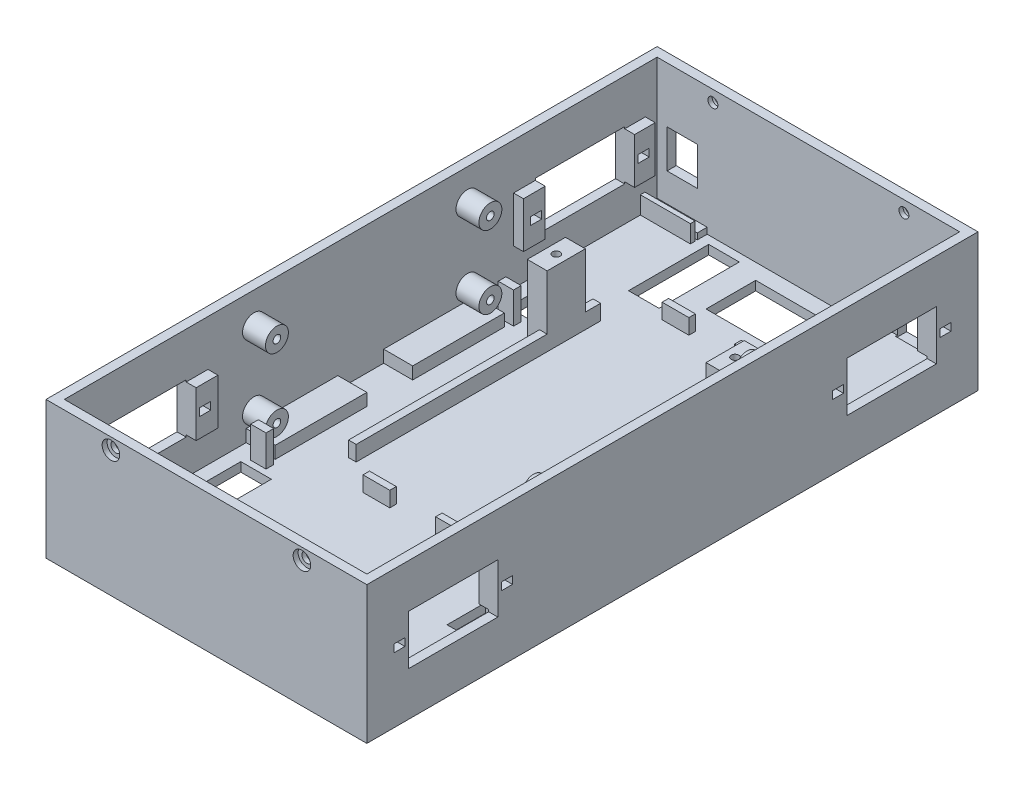
from build123d import *

# Parameters (mm, degrees)
BOSS_EXTRUDE1_START  = -80
SKETCH1_W            = 84
SKETCH1_H            = 36
BOSS_EXTRUDE1_DEPTH  = 160
BOSS_EXTRUDE2_START  = -77.6
SKETCH2_W            = 79.2
SKETCH2_H            = 38.6
BOSS_EXTRUDE2_DEPTH  = 155.2
BOSS_EXTRUDE3_START  = -74.5
SKETCH3_W            = 2.6
SKETCH3_H            = 12
BOSS_EXTRUDE3_DEPTH  = 34.5
BOSS_EXTRUDE4_START  = -69.1
SKETCH4_W            = 7.8
SKETCH4_H            = 13
BOSS_EXTRUDE4_DEPTH  = 23.4
BOSS_EXTRUDE5_START  = -72.925
SKETCH5_W            = 7.8
SKETCH5_H            = 2
BOSS_EXTRUDE5_DEPTH  = 2.9
BOSS_EXTRUDE6_START  = -44.775
SKETCH6_W            = 7.8
SKETCH6_H            = 2
BOSS_EXTRUDE6_DEPTH  = 2.9
BOSS_EXTRUDE7_START  = -45
SKETCH7_W            = 8
SKETCH7_H            = 4.4
BOSS_EXTRUDE7_DEPTH  = 10
BOSS_EXTRUDE8_START  = 40
SKETCH8_W            = 2.6
SKETCH8_H            = 12
BOSS_EXTRUDE8_DEPTH  = 34.5
BOSS_EXTRUDE9_START  = 45.7
SKETCH9_W            = 7.8
SKETCH9_H            = 13
BOSS_EXTRUDE9_DEPTH  = 23.4
BOSS_EXTRUDE10_START = 41.875
SKETCH10_W           = 7.8
SKETCH10_H           = 2
BOSS_EXTRUDE10_DEPTH = 2.9
BOSS_EXTRUDE11_START = 70.025
SKETCH11_W           = 7.8
SKETCH11_H           = 2
BOSS_EXTRUDE11_DEPTH = 2.9
BOSS_EXTRUDE12_START = 35
SKETCH12_W           = 8
SKETCH12_H           = 4.4
BOSS_EXTRUDE12_DEPTH = 10
BOSS_EXTRUDE13_START = -39.6
SKETCH13_R           = 3
BOSS_EXTRUDE13_DEPTH = 6
BOSS_EXTRUDE14_START = -40.4
SKETCH14_R           = 1
BOSS_EXTRUDE14_DEPTH = 7.4
BOSS_EXTRUDE15_START = -39.6
SKETCH15_R           = 3
BOSS_EXTRUDE15_DEPTH = 6
BOSS_EXTRUDE16_START = -40.4
SKETCH16_R           = 1
BOSS_EXTRUDE16_DEPTH = 7.4
BOSS_EXTRUDE17_START = -39.6
SKETCH17_R           = 3
BOSS_EXTRUDE17_DEPTH = 6
BOSS_EXTRUDE18_START = -40.4
SKETCH18_R           = 1
BOSS_EXTRUDE18_DEPTH = 7.4
BOSS_EXTRUDE19_START = -39.6
SKETCH19_R           = 3
BOSS_EXTRUDE19_DEPTH = 6
BOSS_EXTRUDE20_START = -40.4
SKETCH20_R           = 1
BOSS_EXTRUDE20_DEPTH = 7.4
BOSS_EXTRUDE21_START = -30
SKETCH21_W           = 7.6
SKETCH21_H           = 3.2
BOSS_EXTRUDE21_DEPTH = 24
BOSS_EXTRUDE22_START = 6
SKETCH22_W           = 7.6
SKETCH22_H           = 3.2
BOSS_EXTRUDE22_DEPTH = 24
BOSS_EXTRUDE23_START = 31.4
SKETCH23_W           = 4
SKETCH23_H           = 8.2
BOSS_EXTRUDE23_DEPTH = 2
BOSS_EXTRUDE24_START = -33.4
SKETCH24_W           = 4
SKETCH24_H           = 8.2
BOSS_EXTRUDE24_DEPTH = 2
BOSS_EXTRUDE25_START = -44
SKETCH25_W           = 2
SKETCH25_H           = 4
BOSS_EXTRUDE25_DEPTH = 64
BOSS_EXTRUDE26_START = -40
SKETCH26_W           = 5.2
SKETCH26_H           = 18.35
BOSS_EXTRUDE26_DEPTH = 10
BOSS_EXTRUDE27_START = 8
SKETCH27_R           = 1
BOSS_EXTRUDE27_DEPTH = 13.75
BOSS_EXTRUDE28_START = 54.5
SKETCH28_W           = 8
SKETCH28_H           = 4.4
BOSS_EXTRUDE28_DEPTH = 21
BOSS_EXTRUDE29_START = -74.5
SKETCH29_W           = 2.6
SKETCH29_H           = 12
BOSS_EXTRUDE29_DEPTH = 34.5
BOSS_EXTRUDE30_START = -69.1
SKETCH30_W           = 7.8
SKETCH30_H           = 13
BOSS_EXTRUDE30_DEPTH = 23.4
BOSS_EXTRUDE31_START = -72.925
SKETCH31_W           = 7.8
SKETCH31_H           = 2
BOSS_EXTRUDE31_DEPTH = 2.9
BOSS_EXTRUDE32_START = -44.775
SKETCH32_W           = 7.8
SKETCH32_H           = 2
BOSS_EXTRUDE32_DEPTH = 2.9
BOSS_EXTRUDE33_START = -45
SKETCH33_W           = 8
SKETCH33_H           = 4.4
BOSS_EXTRUDE33_DEPTH = 10
BOSS_EXTRUDE34_START = 40
SKETCH34_W           = 2.6
SKETCH34_H           = 12
BOSS_EXTRUDE34_DEPTH = 34.5
BOSS_EXTRUDE35_START = 45.7
SKETCH35_W           = 7.8
SKETCH35_H           = 13
BOSS_EXTRUDE35_DEPTH = 23.4
BOSS_EXTRUDE36_START = 41.875
SKETCH36_W           = 7.8
SKETCH36_H           = 2
BOSS_EXTRUDE36_DEPTH = 2.9
BOSS_EXTRUDE37_START = 70.025
SKETCH37_W           = 7.8
SKETCH37_H           = 2
BOSS_EXTRUDE37_DEPTH = 2.9
BOSS_EXTRUDE38_START = 35
SKETCH38_W           = 8
SKETCH38_H           = 4.4
BOSS_EXTRUDE38_DEPTH = 10
BOSS_EXTRUDE39_START = 33.6
SKETCH39_R           = 3
BOSS_EXTRUDE39_DEPTH = 6
BOSS_EXTRUDE40_START = 33
SKETCH40_R           = 1
BOSS_EXTRUDE40_DEPTH = 7.4
BOSS_EXTRUDE41_START = 33.6
SKETCH41_R           = 3
BOSS_EXTRUDE41_DEPTH = 6
BOSS_EXTRUDE42_START = 33
SKETCH42_R           = 1
BOSS_EXTRUDE42_DEPTH = 7.4
BOSS_EXTRUDE43_START = 33.6
SKETCH43_R           = 3
BOSS_EXTRUDE43_DEPTH = 6
BOSS_EXTRUDE44_START = 33
SKETCH44_R           = 1
BOSS_EXTRUDE44_DEPTH = 7.4
BOSS_EXTRUDE45_START = 33.6
SKETCH45_R           = 3
BOSS_EXTRUDE45_DEPTH = 6
BOSS_EXTRUDE46_START = 33
SKETCH46_R           = 1
BOSS_EXTRUDE46_DEPTH = 7.4
BOSS_EXTRUDE47_START = -30
SKETCH47_W           = 7.6
SKETCH47_H           = 3.2
BOSS_EXTRUDE47_DEPTH = 24
BOSS_EXTRUDE48_START = 6
SKETCH48_W           = 7.6
SKETCH48_H           = 3.2
BOSS_EXTRUDE48_DEPTH = 24
BOSS_EXTRUDE49_START = 31.4
SKETCH49_W           = 4
SKETCH49_H           = 8.2
BOSS_EXTRUDE49_DEPTH = 2
BOSS_EXTRUDE50_START = -33.4
SKETCH50_W           = 4
SKETCH50_H           = 8.2
BOSS_EXTRUDE50_DEPTH = 2
BOSS_EXTRUDE51_START = -44
SKETCH51_W           = 2
SKETCH51_H           = 4
BOSS_EXTRUDE51_DEPTH = 64
BOSS_EXTRUDE52_START = -40
SKETCH52_W           = 5.2
SKETCH52_H           = 18.35
BOSS_EXTRUDE52_DEPTH = 10
BOSS_EXTRUDE53_START = 8
SKETCH53_R           = 1
BOSS_EXTRUDE53_DEPTH = 13.75
BOSS_EXTRUDE54_START = 54.5
SKETCH54_W           = 8
SKETCH54_H           = 4.4
BOSS_EXTRUDE54_DEPTH = 21
BOSS_EXTRUDE55_START = -54
SKETCH55_W           = 7
SKETCH55_H           = 4
BOSS_EXTRUDE55_DEPTH = 1.7
BOSS_EXTRUDE56_START = -54
SKETCH56_W           = 7
SKETCH56_H           = 4
BOSS_EXTRUDE56_DEPTH = 1.7
BOSS_EXTRUDE57_START = 24.3
SKETCH57_W           = 7
SKETCH57_H           = 4
BOSS_EXTRUDE57_DEPTH = 1.7
BOSS_EXTRUDE58_START = 24.3
SKETCH58_W           = 7
SKETCH58_H           = 4
BOSS_EXTRUDE58_DEPTH = 1.7
BOSS_EXTRUDE59_START = -75.5
SKETCH59_W           = 8
SKETCH59_H           = 4.4
BOSS_EXTRUDE59_DEPTH = 21
BOSS_EXTRUDE60_START = -73.5
SKETCH60_W           = 19.4
SKETCH60_H           = 4.4
BOSS_EXTRUDE60_DEPTH = 13
BOSS_EXTRUDE61_START = -77.6
SKETCH61_W           = 18
SKETCH61_H           = 2
BOSS_EXTRUDE61_DEPTH = 31
BOSS_EXTRUDE62_START = -75
SKETCH62_W           = 1.8
SKETCH62_H           = 5
BOSS_EXTRUDE62_DEPTH = 22
BOSS_EXTRUDE63_START = -46.4
SKETCH63_W           = 18.3
SKETCH63_H           = 5
BOSS_EXTRUDE63_DEPTH = 1.2
BOSS_EXTRUDE64_START = -81
SKETCH64_W           = 14
SKETCH64_H           = 7.5
BOSS_EXTRUDE64_DEPTH = 3.9
BOSS_EXTRUDE65_START = -77.6
SKETCH65_W           = 13.1
SKETCH65_H           = 1.6
BOSS_EXTRUDE65_DEPTH = 2.6
BOSS_EXTRUDE66_START = -74.4
SKETCH66_W           = 13.1
SKETCH66_H           = 4.6
BOSS_EXTRUDE66_DEPTH = 1.2
BOSS_EXTRUDE67_START = -81
SKETCH67_W           = 8
SKETCH67_H           = 10
BOSS_EXTRUDE67_DEPTH = 3.9
BOSS_EXTRUDE68_START = -81
SKETCH68_R           = 1.3
BOSS_EXTRUDE68_DEPTH = 4.4
BOSS_EXTRUDE69_START = -81
SKETCH69_R           = 2.3
BOSS_EXTRUDE69_DEPTH = 2.3
BOSS_EXTRUDE70_START = -81
SKETCH70_R           = 1.3
BOSS_EXTRUDE70_DEPTH = 4.4
BOSS_EXTRUDE71_START = -81
SKETCH71_R           = 2.3
BOSS_EXTRUDE71_DEPTH = 2.3
BOSS_EXTRUDE72_START = 76.6
SKETCH72_R           = 1.3
BOSS_EXTRUDE72_DEPTH = 4.4
BOSS_EXTRUDE73_START = 78.7
SKETCH73_R           = 2.3
BOSS_EXTRUDE73_DEPTH = 2.3
BOSS_EXTRUDE74_START = 76.6
SKETCH74_R           = 1.3
BOSS_EXTRUDE74_DEPTH = 4.4
BOSS_EXTRUDE75_START = 78.7
SKETCH75_R           = 2.3
BOSS_EXTRUDE75_DEPTH = 2.3


with BuildPart() as part:
    # Sketch1 → Boss-Extrude1 (new body)
    with BuildSketch(Plane.XY.offset(BOSS_EXTRUDE1_START)):
        with Locations((0, 18)):
            Rectangle(SKETCH1_W, SKETCH1_H)
    extrude(amount=BOSS_EXTRUDE1_DEPTH)


with BuildPart() as body_2:
    # Sketch2 → Boss-Extrude2 (new body)
    with BuildSketch(Plane.XY.offset(BOSS_EXTRUDE2_START)):
        with Locations((0, 21.7)):
            Rectangle(SKETCH2_W, SKETCH2_H)
    extrude(amount=BOSS_EXTRUDE2_DEPTH)


with BuildPart() as part_1:
    add(part.part)

    # Combine1: cut body 2
    add(body_2.part, mode=Mode.SUBTRACT)

    # Sketch3 → Boss-Extrude3 (add)
    with BuildSketch(Plane.XY.offset(BOSS_EXTRUDE3_START)):
        with Locations((-38.3, 18)):
            Rectangle(SKETCH3_W, SKETCH3_H)
    extrude(amount=BOSS_EXTRUDE3_DEPTH)


with BuildPart() as body_2_2:
    # Sketch4 → Boss-Extrude4 (new body)
    with BuildSketch(Plane.XY.offset(BOSS_EXTRUDE4_START)):
        with Locations((-39.1, 18)):
            Rectangle(SKETCH4_W, SKETCH4_H)
    extrude(amount=BOSS_EXTRUDE4_DEPTH)


with BuildPart() as part_2:
    add(part_1.part)

    # Combine2: cut body 2 2
    add(body_2_2.part, mode=Mode.SUBTRACT)


with BuildPart() as body_2_3:
    # Sketch5 → Boss-Extrude5 (new body)
    with BuildSketch(Plane.XY.offset(BOSS_EXTRUDE5_START)):
        with Locations((-39.1, 18)):
            Rectangle(SKETCH5_W, SKETCH5_H)
    extrude(amount=BOSS_EXTRUDE5_DEPTH)


with BuildPart() as part_3:
    add(part_2.part)

    # Combine3: cut body 2 3
    add(body_2_3.part, mode=Mode.SUBTRACT)


with BuildPart() as body_2_4:
    # Sketch6 → Boss-Extrude6 (new body)
    with BuildSketch(Plane.XY.offset(BOSS_EXTRUDE6_START)):
        with Locations((-39.1, 18)):
            Rectangle(SKETCH6_W, SKETCH6_H)
    extrude(amount=BOSS_EXTRUDE6_DEPTH)


with BuildPart() as part_4:
    add(part_3.part)

    # Combine4: cut body 2 4
    add(body_2_4.part, mode=Mode.SUBTRACT)


with BuildPart() as body_2_5:
    # Sketch7 → Boss-Extrude7 (new body)
    with BuildSketch(Plane.XY.offset(BOSS_EXTRUDE7_START)):
        with Locations((-32, 1.2)):
            Rectangle(SKETCH7_W, SKETCH7_H)
    extrude(amount=BOSS_EXTRUDE7_DEPTH)


with BuildPart() as part_5:
    add(part_4.part)

    # Combine5: cut body 2 5
    add(body_2_5.part, mode=Mode.SUBTRACT)

    # Sketch8 → Boss-Extrude8 (add)
    with BuildSketch(Plane.XY.offset(BOSS_EXTRUDE8_START)):
        with Locations((-38.3, 18)):
            Rectangle(SKETCH8_W, SKETCH8_H)
    extrude(amount=BOSS_EXTRUDE8_DEPTH)


with BuildPart() as body_2_6:
    # Sketch9 → Boss-Extrude9 (new body)
    with BuildSketch(Plane.XY.offset(BOSS_EXTRUDE9_START)):
        with Locations((-39.1, 18)):
            Rectangle(SKETCH9_W, SKETCH9_H)
    extrude(amount=BOSS_EXTRUDE9_DEPTH)


with BuildPart() as part_6:
    add(part_5.part)

    # Combine6: cut body 2 6
    add(body_2_6.part, mode=Mode.SUBTRACT)


with BuildPart() as body_2_7:
    # Sketch10 → Boss-Extrude10 (new body)
    with BuildSketch(Plane.XY.offset(BOSS_EXTRUDE10_START)):
        with Locations((-39.1, 18)):
            Rectangle(SKETCH10_W, SKETCH10_H)
    extrude(amount=BOSS_EXTRUDE10_DEPTH)


with BuildPart() as part_7:
    add(part_6.part)

    # Combine7: cut body 2 7
    add(body_2_7.part, mode=Mode.SUBTRACT)


with BuildPart() as body_2_8:
    # Sketch11 → Boss-Extrude11 (new body)
    with BuildSketch(Plane.XY.offset(BOSS_EXTRUDE11_START)):
        with Locations((-39.1, 18)):
            Rectangle(SKETCH11_W, SKETCH11_H)
    extrude(amount=BOSS_EXTRUDE11_DEPTH)


with BuildPart() as part_8:
    add(part_7.part)

    # Combine8: cut body 2 8
    add(body_2_8.part, mode=Mode.SUBTRACT)


with BuildPart() as body_2_9:
    # Sketch12 → Boss-Extrude12 (new body)
    with BuildSketch(Plane.XY.offset(BOSS_EXTRUDE12_START)):
        with Locations((-32, 1.2)):
            Rectangle(SKETCH12_W, SKETCH12_H)
    extrude(amount=BOSS_EXTRUDE12_DEPTH)


with BuildPart() as part_9:
    add(part_8.part)

    # Combine9: cut body 2 9
    add(body_2_9.part, mode=Mode.SUBTRACT)

    # Sketch13 → Boss-Extrude13 (add)
    with BuildSketch(Plane(origin=(0, 0, 0), x_dir=(0, 0, -1), z_dir=(1, 0, 0)).offset(BOSS_EXTRUDE13_START)):
        with Locations((27.94, 8.775)):
            Circle(SKETCH13_R)
    extrude(amount=BOSS_EXTRUDE13_DEPTH)


with BuildPart() as body_2_10:
    # Sketch14 → Boss-Extrude14 (new body)
    with BuildSketch(Plane(origin=(0, 0, 0), x_dir=(0, 0, -1), z_dir=(1, 0, 0)).offset(BOSS_EXTRUDE14_START)):
        with Locations((27.94, 8.775)):
            Circle(SKETCH14_R)
    extrude(amount=BOSS_EXTRUDE14_DEPTH)


with BuildPart() as part_10:
    add(part_9.part)

    # Combine10: cut body 2 10
    add(body_2_10.part, mode=Mode.SUBTRACT)

    # Sketch15 → Boss-Extrude15 (add)
    with BuildSketch(Plane(origin=(0, 0, 0), x_dir=(0, 0, -1), z_dir=(1, 0, 0)).offset(BOSS_EXTRUDE15_START)):
        with Locations((27.94, 27.825)):
            Circle(SKETCH15_R)
    extrude(amount=BOSS_EXTRUDE15_DEPTH)


with BuildPart() as body_2_11:
    # Sketch16 → Boss-Extrude16 (new body)
    with BuildSketch(Plane(origin=(0, 0, 0), x_dir=(0, 0, -1), z_dir=(1, 0, 0)).offset(BOSS_EXTRUDE16_START)):
        with Locations((27.94, 27.825)):
            Circle(SKETCH16_R)
    extrude(amount=BOSS_EXTRUDE16_DEPTH)


with BuildPart() as part_11:
    add(part_10.part)

    # Combine11: cut body 2 11
    add(body_2_11.part, mode=Mode.SUBTRACT)

    # Sketch17 → Boss-Extrude17 (add)
    with BuildSketch(Plane(origin=(0, 0, 0), x_dir=(0, 0, -1), z_dir=(1, 0, 0)).offset(BOSS_EXTRUDE17_START)):
        with Locations((-27.94, 8.775)):
            Circle(SKETCH17_R)
    extrude(amount=BOSS_EXTRUDE17_DEPTH)


with BuildPart() as body_2_12:
    # Sketch18 → Boss-Extrude18 (new body)
    with BuildSketch(Plane(origin=(0, 0, 0), x_dir=(0, 0, -1), z_dir=(1, 0, 0)).offset(BOSS_EXTRUDE18_START)):
        with Locations((-27.94, 8.775)):
            Circle(SKETCH18_R)
    extrude(amount=BOSS_EXTRUDE18_DEPTH)


with BuildPart() as part_12:
    add(part_11.part)

    # Combine12: cut body 2 12
    add(body_2_12.part, mode=Mode.SUBTRACT)

    # Sketch19 → Boss-Extrude19 (add)
    with BuildSketch(Plane(origin=(0, 0, 0), x_dir=(0, 0, -1), z_dir=(1, 0, 0)).offset(BOSS_EXTRUDE19_START)):
        with Locations((-27.94, 27.825)):
            Circle(SKETCH19_R)
    extrude(amount=BOSS_EXTRUDE19_DEPTH)


with BuildPart() as body_2_13:
    # Sketch20 → Boss-Extrude20 (new body)
    with BuildSketch(Plane(origin=(0, 0, 0), x_dir=(0, 0, -1), z_dir=(1, 0, 0)).offset(BOSS_EXTRUDE20_START)):
        with Locations((-27.94, 27.825)):
            Circle(SKETCH20_R)
    extrude(amount=BOSS_EXTRUDE20_DEPTH)


with BuildPart() as part_13:
    add(part_12.part)

    # Combine13: cut body 2 13
    add(body_2_13.part, mode=Mode.SUBTRACT)

    # Sketch21 → Boss-Extrude21 (add)
    with BuildSketch(Plane.XY.offset(BOSS_EXTRUDE21_START)):
        with Locations((-35.8, 4)):
            Rectangle(SKETCH21_W, SKETCH21_H)
    extrude(amount=BOSS_EXTRUDE21_DEPTH)

    # Sketch22 → Boss-Extrude22 (add)
    with BuildSketch(Plane.XY.offset(BOSS_EXTRUDE22_START)):
        with Locations((-35.8, 4)):
            Rectangle(SKETCH22_W, SKETCH22_H)
    extrude(amount=BOSS_EXTRUDE22_DEPTH)

    # Sketch23 → Boss-Extrude23 (add)
    with BuildSketch(Plane.XY.offset(BOSS_EXTRUDE23_START)):
        with Locations((-33, 6.5)):
            Rectangle(SKETCH23_W, SKETCH23_H)
    extrude(amount=BOSS_EXTRUDE23_DEPTH)

    # Sketch24 → Boss-Extrude24 (add)
    with BuildSketch(Plane.XY.offset(BOSS_EXTRUDE24_START)):
        with Locations((-33, 6.5)):
            Rectangle(SKETCH24_W, SKETCH24_H)
    extrude(amount=BOSS_EXTRUDE24_DEPTH)

    # Sketch25 → Boss-Extrude25 (add)
    with BuildSketch(Plane.XY.offset(BOSS_EXTRUDE25_START)):
        with Locations((-21.8, 4.4)):
            Rectangle(SKETCH25_W, SKETCH25_H)
    extrude(amount=BOSS_EXTRUDE25_DEPTH)

    # Sketch26 → Boss-Extrude26 (add)
    with BuildSketch(Plane.XY.offset(BOSS_EXTRUDE26_START)):
        with Locations((-23.4, 11.575)):
            Rectangle(SKETCH26_W, SKETCH26_H)
    extrude(amount=BOSS_EXTRUDE26_DEPTH)


with BuildPart() as body_2_14:
    # Sketch27 → Boss-Extrude27 (new body)
    with BuildSketch(Plane(origin=(0, 0, 0), x_dir=(1, 0, 0), z_dir=(0, 1, 0)).offset(BOSS_EXTRUDE27_START)):
        with Locations((-23.4, 35)):
            Circle(SKETCH27_R)
    extrude(amount=BOSS_EXTRUDE27_DEPTH)


with BuildPart() as part_14:
    add(part_13.part)

    # Combine14: cut body 2 14
    add(body_2_14.part, mode=Mode.SUBTRACT)


with BuildPart() as body_2_15:
    # Sketch28 → Boss-Extrude28 (new body)
    with BuildSketch(Plane.XY.offset(BOSS_EXTRUDE28_START)):
        with Locations((-20, 1.2)):
            Rectangle(SKETCH28_W, SKETCH28_H)
    extrude(amount=BOSS_EXTRUDE28_DEPTH)


with BuildPart() as part_15:
    add(part_14.part)

    # Combine15: cut body 2 15
    add(body_2_15.part, mode=Mode.SUBTRACT)

    # Sketch29 → Boss-Extrude29 (add)
    with BuildSketch(Plane.XY.offset(BOSS_EXTRUDE29_START)):
        with Locations((38.3, 18)):
            Rectangle(SKETCH29_W, SKETCH29_H)
    extrude(amount=BOSS_EXTRUDE29_DEPTH)


with BuildPart() as body_2_16:
    # Sketch30 → Boss-Extrude30 (new body)
    with BuildSketch(Plane.XY.offset(BOSS_EXTRUDE30_START)):
        with Locations((39.1, 18)):
            Rectangle(SKETCH30_W, SKETCH30_H)
    extrude(amount=BOSS_EXTRUDE30_DEPTH)


with BuildPart() as part_16:
    add(part_15.part)

    # Combine16: cut body 2 16
    add(body_2_16.part, mode=Mode.SUBTRACT)


with BuildPart() as body_2_17:
    # Sketch31 → Boss-Extrude31 (new body)
    with BuildSketch(Plane.XY.offset(BOSS_EXTRUDE31_START)):
        with Locations((39.1, 18)):
            Rectangle(SKETCH31_W, SKETCH31_H)
    extrude(amount=BOSS_EXTRUDE31_DEPTH)


with BuildPart() as part_17:
    add(part_16.part)

    # Combine17: cut body 2 17
    add(body_2_17.part, mode=Mode.SUBTRACT)


with BuildPart() as body_2_18:
    # Sketch32 → Boss-Extrude32 (new body)
    with BuildSketch(Plane.XY.offset(BOSS_EXTRUDE32_START)):
        with Locations((39.1, 18)):
            Rectangle(SKETCH32_W, SKETCH32_H)
    extrude(amount=BOSS_EXTRUDE32_DEPTH)


with BuildPart() as part_18:
    add(part_17.part)

    # Combine18: cut body 2 18
    add(body_2_18.part, mode=Mode.SUBTRACT)


with BuildPart() as body_2_19:
    # Sketch33 → Boss-Extrude33 (new body)
    with BuildSketch(Plane.XY.offset(BOSS_EXTRUDE33_START)):
        with Locations((32, 1.2)):
            Rectangle(SKETCH33_W, SKETCH33_H)
    extrude(amount=BOSS_EXTRUDE33_DEPTH)


with BuildPart() as part_19:
    add(part_18.part)

    # Combine19: cut body 2 19
    add(body_2_19.part, mode=Mode.SUBTRACT)

    # Sketch34 → Boss-Extrude34 (add)
    with BuildSketch(Plane.XY.offset(BOSS_EXTRUDE34_START)):
        with Locations((38.3, 18)):
            Rectangle(SKETCH34_W, SKETCH34_H)
    extrude(amount=BOSS_EXTRUDE34_DEPTH)


with BuildPart() as body_2_20:
    # Sketch35 → Boss-Extrude35 (new body)
    with BuildSketch(Plane.XY.offset(BOSS_EXTRUDE35_START)):
        with Locations((39.1, 18)):
            Rectangle(SKETCH35_W, SKETCH35_H)
    extrude(amount=BOSS_EXTRUDE35_DEPTH)


with BuildPart() as part_20:
    add(part_19.part)

    # Combine20: cut body 2 20
    add(body_2_20.part, mode=Mode.SUBTRACT)


with BuildPart() as body_2_21:
    # Sketch36 → Boss-Extrude36 (new body)
    with BuildSketch(Plane.XY.offset(BOSS_EXTRUDE36_START)):
        with Locations((39.1, 18)):
            Rectangle(SKETCH36_W, SKETCH36_H)
    extrude(amount=BOSS_EXTRUDE36_DEPTH)


with BuildPart() as part_21:
    add(part_20.part)

    # Combine21: cut body 2 21
    add(body_2_21.part, mode=Mode.SUBTRACT)


with BuildPart() as body_2_22:
    # Sketch37 → Boss-Extrude37 (new body)
    with BuildSketch(Plane.XY.offset(BOSS_EXTRUDE37_START)):
        with Locations((39.1, 18)):
            Rectangle(SKETCH37_W, SKETCH37_H)
    extrude(amount=BOSS_EXTRUDE37_DEPTH)


with BuildPart() as part_22:
    add(part_21.part)

    # Combine22: cut body 2 22
    add(body_2_22.part, mode=Mode.SUBTRACT)


with BuildPart() as body_2_23:
    # Sketch38 → Boss-Extrude38 (new body)
    with BuildSketch(Plane.XY.offset(BOSS_EXTRUDE38_START)):
        with Locations((32, 1.2)):
            Rectangle(SKETCH38_W, SKETCH38_H)
    extrude(amount=BOSS_EXTRUDE38_DEPTH)


with BuildPart() as part_23:
    add(part_22.part)

    # Combine23: cut body 2 23
    add(body_2_23.part, mode=Mode.SUBTRACT)

    # Sketch39 → Boss-Extrude39 (add)
    with BuildSketch(Plane(origin=(0, 0, 0), x_dir=(0, 0, -1), z_dir=(1, 0, 0)).offset(BOSS_EXTRUDE39_START)):
        with Locations((27.94, 8.775)):
            Circle(SKETCH39_R)
    extrude(amount=BOSS_EXTRUDE39_DEPTH)


with BuildPart() as body_2_24:
    # Sketch40 → Boss-Extrude40 (new body)
    with BuildSketch(Plane(origin=(0, 0, 0), x_dir=(0, 0, -1), z_dir=(1, 0, 0)).offset(BOSS_EXTRUDE40_START)):
        with Locations((27.94, 8.775)):
            Circle(SKETCH40_R)
    extrude(amount=BOSS_EXTRUDE40_DEPTH)


with BuildPart() as part_24:
    add(part_23.part)

    # Combine24: cut body 2 24
    add(body_2_24.part, mode=Mode.SUBTRACT)

    # Sketch41 → Boss-Extrude41 (add)
    with BuildSketch(Plane(origin=(0, 0, 0), x_dir=(0, 0, -1), z_dir=(1, 0, 0)).offset(BOSS_EXTRUDE41_START)):
        with Locations((27.94, 27.825)):
            Circle(SKETCH41_R)
    extrude(amount=BOSS_EXTRUDE41_DEPTH)


with BuildPart() as body_2_25:
    # Sketch42 → Boss-Extrude42 (new body)
    with BuildSketch(Plane(origin=(0, 0, 0), x_dir=(0, 0, -1), z_dir=(1, 0, 0)).offset(BOSS_EXTRUDE42_START)):
        with Locations((27.94, 27.825)):
            Circle(SKETCH42_R)
    extrude(amount=BOSS_EXTRUDE42_DEPTH)


with BuildPart() as part_25:
    add(part_24.part)

    # Combine25: cut body 2 25
    add(body_2_25.part, mode=Mode.SUBTRACT)

    # Sketch43 → Boss-Extrude43 (add)
    with BuildSketch(Plane(origin=(0, 0, 0), x_dir=(0, 0, -1), z_dir=(1, 0, 0)).offset(BOSS_EXTRUDE43_START)):
        with Locations((-27.94, 8.775)):
            Circle(SKETCH43_R)
    extrude(amount=BOSS_EXTRUDE43_DEPTH)


with BuildPart() as body_2_26:
    # Sketch44 → Boss-Extrude44 (new body)
    with BuildSketch(Plane(origin=(0, 0, 0), x_dir=(0, 0, -1), z_dir=(1, 0, 0)).offset(BOSS_EXTRUDE44_START)):
        with Locations((-27.94, 8.775)):
            Circle(SKETCH44_R)
    extrude(amount=BOSS_EXTRUDE44_DEPTH)


with BuildPart() as part_26:
    add(part_25.part)

    # Combine26: cut body 2 26
    add(body_2_26.part, mode=Mode.SUBTRACT)

    # Sketch45 → Boss-Extrude45 (add)
    with BuildSketch(Plane(origin=(0, 0, 0), x_dir=(0, 0, -1), z_dir=(1, 0, 0)).offset(BOSS_EXTRUDE45_START)):
        with Locations((-27.94, 27.825)):
            Circle(SKETCH45_R)
    extrude(amount=BOSS_EXTRUDE45_DEPTH)


with BuildPart() as body_2_27:
    # Sketch46 → Boss-Extrude46 (new body)
    with BuildSketch(Plane(origin=(0, 0, 0), x_dir=(0, 0, -1), z_dir=(1, 0, 0)).offset(BOSS_EXTRUDE46_START)):
        with Locations((-27.94, 27.825)):
            Circle(SKETCH46_R)
    extrude(amount=BOSS_EXTRUDE46_DEPTH)


with BuildPart() as part_27:
    add(part_26.part)

    # Combine27: cut body 2 27
    add(body_2_27.part, mode=Mode.SUBTRACT)

    # Sketch47 → Boss-Extrude47 (add)
    with BuildSketch(Plane.XY.offset(BOSS_EXTRUDE47_START)):
        with Locations((35.8, 4)):
            Rectangle(SKETCH47_W, SKETCH47_H)
    extrude(amount=BOSS_EXTRUDE47_DEPTH)

    # Sketch48 → Boss-Extrude48 (add)
    with BuildSketch(Plane.XY.offset(BOSS_EXTRUDE48_START)):
        with Locations((35.8, 4)):
            Rectangle(SKETCH48_W, SKETCH48_H)
    extrude(amount=BOSS_EXTRUDE48_DEPTH)

    # Sketch49 → Boss-Extrude49 (add)
    with BuildSketch(Plane.XY.offset(BOSS_EXTRUDE49_START)):
        with Locations((33, 6.5)):
            Rectangle(SKETCH49_W, SKETCH49_H)
    extrude(amount=BOSS_EXTRUDE49_DEPTH)

    # Sketch50 → Boss-Extrude50 (add)
    with BuildSketch(Plane.XY.offset(BOSS_EXTRUDE50_START)):
        with Locations((33, 6.5)):
            Rectangle(SKETCH50_W, SKETCH50_H)
    extrude(amount=BOSS_EXTRUDE50_DEPTH)

    # Sketch51 → Boss-Extrude51 (add)
    with BuildSketch(Plane.XY.offset(BOSS_EXTRUDE51_START)):
        with Locations((21.8, 4.4)):
            Rectangle(SKETCH51_W, SKETCH51_H)
    extrude(amount=BOSS_EXTRUDE51_DEPTH)

    # Sketch52 → Boss-Extrude52 (add)
    with BuildSketch(Plane.XY.offset(BOSS_EXTRUDE52_START)):
        with Locations((23.4, 11.575)):
            Rectangle(SKETCH52_W, SKETCH52_H)
    extrude(amount=BOSS_EXTRUDE52_DEPTH)


with BuildPart() as body_2_28:
    # Sketch53 → Boss-Extrude53 (new body)
    with BuildSketch(Plane(origin=(0, 0, 0), x_dir=(1, 0, 0), z_dir=(0, 1, 0)).offset(BOSS_EXTRUDE53_START)):
        with Locations((23.4, 35)):
            Circle(SKETCH53_R)
    extrude(amount=BOSS_EXTRUDE53_DEPTH)


with BuildPart() as part_28:
    add(part_27.part)

    # Combine28: cut body 2 28
    add(body_2_28.part, mode=Mode.SUBTRACT)


with BuildPart() as body_2_29:
    # Sketch54 → Boss-Extrude54 (new body)
    with BuildSketch(Plane.XY.offset(BOSS_EXTRUDE54_START)):
        with Locations((20, 1.2)):
            Rectangle(SKETCH54_W, SKETCH54_H)
    extrude(amount=BOSS_EXTRUDE54_DEPTH)


with BuildPart() as part_29:
    add(part_28.part)

    # Combine29: cut body 2 29
    add(body_2_29.part, mode=Mode.SUBTRACT)

    # Sketch55 → Boss-Extrude55 (add)
    with BuildSketch(Plane.XY.offset(BOSS_EXTRUDE55_START)):
        with Locations((-9.5, 4.4)):
            Rectangle(SKETCH55_W, SKETCH55_H)
    extrude(amount=BOSS_EXTRUDE55_DEPTH)

    # Sketch56 → Boss-Extrude56 (add)
    with BuildSketch(Plane.XY.offset(BOSS_EXTRUDE56_START)):
        with Locations((9.5, 4.4)):
            Rectangle(SKETCH56_W, SKETCH56_H)
    extrude(amount=BOSS_EXTRUDE56_DEPTH)

    # Sketch57 → Boss-Extrude57 (add)
    with BuildSketch(Plane.XY.offset(BOSS_EXTRUDE57_START)):
        with Locations((-9.5, 4.4)):
            Rectangle(SKETCH57_W, SKETCH57_H)
    extrude(amount=BOSS_EXTRUDE57_DEPTH)

    # Sketch58 → Boss-Extrude58 (add)
    with BuildSketch(Plane.XY.offset(BOSS_EXTRUDE58_START)):
        with Locations((9.5, 4.4)):
            Rectangle(SKETCH58_W, SKETCH58_H)
    extrude(amount=BOSS_EXTRUDE58_DEPTH)


with BuildPart() as body_2_30:
    # Sketch59 → Boss-Extrude59 (new body)
    with BuildSketch(Plane.XY.offset(BOSS_EXTRUDE59_START)):
        with Locations((-20, 1.2)):
            Rectangle(SKETCH59_W, SKETCH59_H)
    extrude(amount=BOSS_EXTRUDE59_DEPTH)


with BuildPart() as part_30:
    add(part_29.part)

    # Combine30: cut body 2 30
    add(body_2_30.part, mode=Mode.SUBTRACT)


with BuildPart() as body_2_31:
    # Sketch60 → Boss-Extrude60 (new body)
    with BuildSketch(Plane.XY.offset(BOSS_EXTRUDE60_START)):
        with Locations((0, 1.2)):
            Rectangle(SKETCH60_W, SKETCH60_H)
    extrude(amount=BOSS_EXTRUDE60_DEPTH)


with BuildPart() as part_31:
    add(part_30.part)

    # Combine31: cut body 2 31
    add(body_2_31.part, mode=Mode.SUBTRACT)

    # Sketch61 → Boss-Extrude61 (add)
    with BuildSketch(Plane.XY.offset(BOSS_EXTRUDE61_START)):
        with Locations((30.3, 3.4)):
            Rectangle(SKETCH61_W, SKETCH61_H)
    extrude(amount=BOSS_EXTRUDE61_DEPTH)

    # Sketch62 → Boss-Extrude62 (add)
    with BuildSketch(Plane.XY.offset(BOSS_EXTRUDE62_START)):
        with Locations((20.4, 4.9)):
            Rectangle(SKETCH62_W, SKETCH62_H)
    extrude(amount=BOSS_EXTRUDE62_DEPTH)

    # Sketch63 → Boss-Extrude63 (add)
    with BuildSketch(Plane.XY.offset(BOSS_EXTRUDE63_START)):
        with Locations((30.45, 4.9)):
            Rectangle(SKETCH63_W, SKETCH63_H)
    extrude(amount=BOSS_EXTRUDE63_DEPTH)


with BuildPart() as body_2_32:
    # Sketch64 → Boss-Extrude64 (new body)
    with BuildSketch(Plane.XY.offset(BOSS_EXTRUDE64_START)):
        with Locations((30.3, 7.75)):
            Rectangle(SKETCH64_W, SKETCH64_H)
    extrude(amount=BOSS_EXTRUDE64_DEPTH)


with BuildPart() as part_32:
    add(part_31.part)

    # Combine32: cut body 2 32
    add(body_2_32.part, mode=Mode.SUBTRACT)

    # Sketch65 → Boss-Extrude65 (add)
    with BuildSketch(Plane.XY.offset(BOSS_EXTRUDE65_START)):
        with Locations((-33.05, 3.2)):
            Rectangle(SKETCH65_W, SKETCH65_H)
    extrude(amount=BOSS_EXTRUDE65_DEPTH)

    # Sketch66 → Boss-Extrude66 (add)
    with BuildSketch(Plane.XY.offset(BOSS_EXTRUDE66_START)):
        with Locations((-33.05, 4.7)):
            Rectangle(SKETCH66_W, SKETCH66_H)
    extrude(amount=BOSS_EXTRUDE66_DEPTH)


with BuildPart() as body_2_33:
    # Sketch67 → Boss-Extrude67 (new body)
    with BuildSketch(Plane.XY.offset(BOSS_EXTRUDE67_START)):
        with Locations((-33, 16.5)):
            Rectangle(SKETCH67_W, SKETCH67_H)
    extrude(amount=BOSS_EXTRUDE67_DEPTH)


with BuildPart() as part_33:
    add(part_32.part)

    # Combine33: cut body 2 33
    add(body_2_33.part, mode=Mode.SUBTRACT)


with BuildPart() as body_2_34:
    # Sketch68 → Boss-Extrude68 (new body)
    with BuildSketch(Plane.XY.offset(BOSS_EXTRUDE68_START)):
        with Locations((-25, 33)):
            Circle(SKETCH68_R)
    extrude(amount=BOSS_EXTRUDE68_DEPTH)


with BuildPart() as part_34:
    add(part_33.part)

    # Combine34: cut body 2 34
    add(body_2_34.part, mode=Mode.SUBTRACT)


with BuildPart() as body_2_35:
    # Sketch69 → Boss-Extrude69 (new body)
    with BuildSketch(Plane.XY.offset(BOSS_EXTRUDE69_START)):
        with Locations((-25, 33)):
            Circle(SKETCH69_R)
    extrude(amount=BOSS_EXTRUDE69_DEPTH)


with BuildPart() as part_35:
    add(part_34.part)

    # Combine35: cut body 2 35
    add(body_2_35.part, mode=Mode.SUBTRACT)


with BuildPart() as body_2_36:
    # Sketch70 → Boss-Extrude70 (new body)
    with BuildSketch(Plane.XY.offset(BOSS_EXTRUDE70_START)):
        with Locations((25, 33)):
            Circle(SKETCH70_R)
    extrude(amount=BOSS_EXTRUDE70_DEPTH)


with BuildPart() as part_36:
    add(part_35.part)

    # Combine36: cut body 2 36
    add(body_2_36.part, mode=Mode.SUBTRACT)


with BuildPart() as body_2_37:
    # Sketch71 → Boss-Extrude71 (new body)
    with BuildSketch(Plane.XY.offset(BOSS_EXTRUDE71_START)):
        with Locations((25, 33)):
            Circle(SKETCH71_R)
    extrude(amount=BOSS_EXTRUDE71_DEPTH)


with BuildPart() as part_37:
    add(part_36.part)

    # Combine37: cut body 2 37
    add(body_2_37.part, mode=Mode.SUBTRACT)


with BuildPart() as body_2_38:
    # Sketch72 → Boss-Extrude72 (new body)
    with BuildSketch(Plane.XY.offset(BOSS_EXTRUDE72_START)):
        with Locations((-25, 33)):
            Circle(SKETCH72_R)
    extrude(amount=BOSS_EXTRUDE72_DEPTH)


with BuildPart() as part_38:
    add(part_37.part)

    # Combine38: cut body 2 38
    add(body_2_38.part, mode=Mode.SUBTRACT)


with BuildPart() as body_2_39:
    # Sketch73 → Boss-Extrude73 (new body)
    with BuildSketch(Plane.XY.offset(BOSS_EXTRUDE73_START)):
        with Locations((-25, 33)):
            Circle(SKETCH73_R)
    extrude(amount=BOSS_EXTRUDE73_DEPTH)


with BuildPart() as part_39:
    add(part_38.part)

    # Combine39: cut body 2 39
    add(body_2_39.part, mode=Mode.SUBTRACT)


with BuildPart() as body_2_40:
    # Sketch74 → Boss-Extrude74 (new body)
    with BuildSketch(Plane.XY.offset(BOSS_EXTRUDE74_START)):
        with Locations((25, 33)):
            Circle(SKETCH74_R)
    extrude(amount=BOSS_EXTRUDE74_DEPTH)


with BuildPart() as part_40:
    add(part_39.part)

    # Combine40: cut body 2 40
    add(body_2_40.part, mode=Mode.SUBTRACT)


with BuildPart() as body_2_41:
    # Sketch75 → Boss-Extrude75 (new body)
    with BuildSketch(Plane.XY.offset(BOSS_EXTRUDE75_START)):
        with Locations((25, 33)):
            Circle(SKETCH75_R)
    extrude(amount=BOSS_EXTRUDE75_DEPTH)


with BuildPart() as part_41:
    add(part_40.part)

    # Combine41: cut body 2 41
    add(body_2_41.part, mode=Mode.SUBTRACT)


solid = part_41.part
